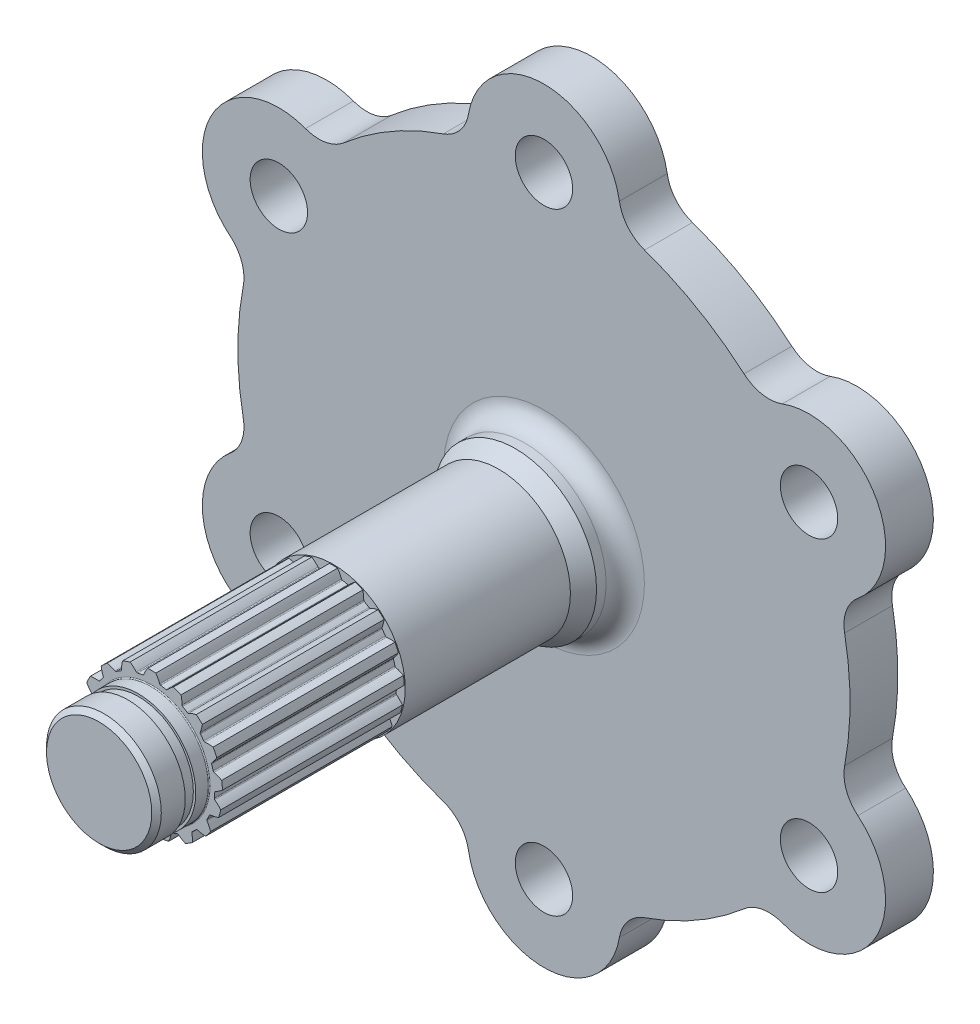
from build123d import *

# Parameters (mm, degrees)
SKETCH1_R           = 3
BOSS_EXTRUDE1_DEPTH = 5
SKETCH3_R           = 7.5
BOSS_EXTRUDE2_DEPTH = 22
BOSS_EXTRUDE7_DEPTH = 19
SKETCH4_R           = 6
BOSS_EXTRUDE3_DEPTH = 5.5
SKETCH6_R           = 8.5
BOSS_EXTRUDE5_DEPTH = 3
FILLET1_R           = 2
CHAMFER2_SIZE2      = 1.732050808
CHAMFER2_SIZE       = 1
CHAMFER3_SIZE       = 0.5
FILLET2_R           = 0.1
FILLET3_R           = 4
SKETCH12_W          = 1.1
SKETCH12_H          = 0.25
SKETCH13_R          = 24
SKETCH13_R_2        = 21
BOSS_EXTRUDE8_DEPTH = 4
CHAMFER4_SIZE       = 1


with BuildPart() as part:
    # Sketch1 → Boss-Extrude1 (new body)
    with BuildSketch(Plane.XY):
        with BuildLine():
            ThreePointArc((-7.937253933, 31), (-16, 27.712812921), (-22.878160551, 22.373863542))
            ThreePointArc((-22.878160551, 22.373863542), (-34.641016151, 20), (-30.815414484, 8.626136458))
            ThreePointArc((-30.815414484, 8.626136458), (-32, 0), (-30.815414484, -8.626136458))
            ThreePointArc((-30.815414484, -8.626136458), (-34.641016151, -20), (-22.878160551, -22.373863542))
            ThreePointArc((-22.878160551, -22.373863542), (-16, -27.712812921), (-7.937253933, -31))
            ThreePointArc((-7.937253933, -31), (0, -40), (7.937253933, -31))
            ThreePointArc((7.937253933, -31), (16, -27.712812921), (22.878160551, -22.373863542))
            ThreePointArc((22.878160551, -22.373863542), (34.641016151, -20), (30.815414484, -8.626136458))
            ThreePointArc((30.815414484, -8.626136458), (32, 0), (30.815414484, 8.626136458))
            ThreePointArc((30.815414484, 8.626136458), (34.641016151, 20), (22.878160551, 22.373863542))
            ThreePointArc((22.878160551, 22.373863542), (16, 27.712812921), (7.937253933, 31))
            ThreePointArc((7.937253933, 31), (0, 40), (-7.937253933, 31))
        make_face()
        with Locations((0, 32)):
            Circle(SKETCH1_R, mode=Mode.SUBTRACT)
        with Locations((27.712812921, 16)):
            Circle(SKETCH1_R, mode=Mode.SUBTRACT)
        with Locations((27.712812921, -16)):
            Circle(SKETCH1_R, mode=Mode.SUBTRACT)
        with Locations((0, -32)):
            Circle(SKETCH1_R, mode=Mode.SUBTRACT)
        with Locations((-27.712812921, -16)):
            Circle(SKETCH1_R, mode=Mode.SUBTRACT)
        with Locations((-27.712812921, 16)):
            Circle(SKETCH1_R, mode=Mode.SUBTRACT)
    extrude(amount=BOSS_EXTRUDE1_DEPTH)

    # Sketch3 → Boss-Extrude2 (add)
    with BuildSketch(Plane.XY.offset(5)):
        Circle(SKETCH3_R)
    extrude(amount=BOSS_EXTRUDE2_DEPTH)

    # Sketch9 → Boss-Extrude7 (add)
    with BuildSketch(Plane.XY.offset(27)):
        with BuildLine():
            ThreePointArc((3.065434453, 6.727003422), (2.670494178, 6.893324312), (2.266580134, 7.036481234))
            add(Edge.make_bspline(
                [(2.266580134, 7.036481234), (2.126818387, 6.938788398), (1.999963915, 6.840591067), (1.8857083, 6.743110628), (1.783612796, 6.647519469), (1.693117386, 6.554921304), (1.613554225, 6.466335435)],
                knots=[0, 0, 0, 0, 0, 0, 0, 1, 1, 1, 1, 1, 1, 1], degree=6))
            add(Edge.make_bspline(
                [(1.613554225, 6.466335435), (1.598164962, 6.44910015), (1.558045018, 6.423044176), (1.510221243, 6.420988968), (1.487755535, 6.426241211)],
                knots=[0, 0, 0, 0, 0.500434337, 1, 1, 1, 1], degree=3))
            ThreePointArc((1.487755535, 6.426241211), (1.350215953, 6.456539837), (1.212060845, 6.483895085))
            ThreePointArc((1.212060845, 6.483895085), (1.073353189, 6.508294458), (0.934156222, 6.529726857))
            add(Edge.make_bspline(
                [(0.934156222, 6.529726857), (0.911310245, 6.532944837), (0.867458329, 6.552137202), (0.839460099, 6.590926668), (0.831336141, 6.612557336)],
                knots=[0, 0, 0, 0, 0.499565663, 1, 1, 1, 1], degree=3))
            add(Edge.make_bspline(
                [(0.831336141, 6.612557336), (0.78914661, 6.723902728), (0.738212469, 6.842938658), (0.677542756, 6.968955909), (0.606216565, 7.101127601), (0.52340126, 7.238519005), (0.428368035, 7.380102628)],
                knots=[0, 0, 0, 0, 0, 0, 0, 1, 1, 1, 1, 1, 1, 1], degree=6))
            ThreePointArc((0.428368035, 7.380102628), (1.5161e-05, 7.392523356), (-0.428337714, 7.380102628))
            add(Edge.make_bspline(
                [(-0.428337714, 7.380102628), (-0.523370939, 7.238519005), (-0.606186244, 7.101127601), (-0.677512435, 6.968955909), (-0.738182148, 6.842938658), (-0.789116289, 6.723902728), (-0.83130582, 6.612557336)],
                knots=[0, 0, 0, 0, 0, 0, 0, 1, 1, 1, 1, 1, 1, 1], degree=6))
            add(Edge.make_bspline(
                [(-0.83130582, 6.612557336), (-0.839429778, 6.590926668), (-0.867428008, 6.552137202), (-0.911279924, 6.532944837), (-0.934125901, 6.529726857)],
                knots=[0, 0, 0, 0, 0.500434337, 1, 1, 1, 1], degree=3))
            ThreePointArc((-0.934125901, 6.529726857), (-1.073322868, 6.508294458), (-1.212030524, 6.483895085))
            ThreePointArc((-1.212030524, 6.483895085), (-1.350185632, 6.456539837), (-1.487725214, 6.426241211))
            add(Edge.make_bspline(
                [(-1.487725214, 6.426241211), (-1.510190921, 6.420988968), (-1.558014697, 6.423044176), (-1.598134641, 6.44910015), (-1.613523904, 6.466335435)],
                knots=[0, 0, 0, 0, 0.499565663, 1, 1, 1, 1], degree=3))
            add(Edge.make_bspline(
                [(-1.613523904, 6.466335435), (-1.693087065, 6.554921304), (-1.783582475, 6.647519469), (-1.885677979, 6.743110628), (-1.999933594, 6.840591067), (-2.126788065, 6.938788398), (-2.266549813, 7.036481234)],
                knots=[0, 0, 0, 0, 0, 0, 0, 1, 1, 1, 1, 1, 1, 1], degree=6))
            ThreePointArc((-2.266549813, 7.036481234), (-2.670463857, 6.893324312), (-3.065404132, 6.727003422))
            add(Edge.make_bspline(
                [(-3.065404132, 6.727003422), (-3.102874071, 6.560650664), (-3.130465543, 6.402620657), (-3.149229314, 6.253608232), (-3.160279454, 6.114184218), (-3.164773389, 5.984786985), (-3.16389136, 5.865719882)],
                knots=[0, 0, 0, 0, 0, 0, 0, 1, 1, 1, 1, 1, 1, 1], degree=6))
            add(Edge.make_bspline(
                [(-3.16389136, 5.865719882), (-3.163652827, 5.842615173), (-3.175748027, 5.796330945), (-3.209705639, 5.762593459), (-3.22984641, 5.751339864)],
                knots=[0, 0, 0, 0, 0.500434337, 1, 1, 1, 1], degree=3))
            ThreePointArc((-3.22984641, 5.751339864), (-3.35190144, 5.681071002), (-3.472428408, 5.60821228))
            ThreePointArc((-3.472428408, 5.60821228), (-3.591372354, 5.53279689), (-3.708679068, 5.454859234))
            add(Edge.make_bspline(
                [(-3.708679068, 5.454859234), (-3.727730388, 5.441846114), (-3.773067157, 5.426486598), (-3.819890394, 5.436290074), (-3.840466558, 5.446802256)],
                knots=[0, 0, 0, 0, 0.499565663, 1, 1, 1, 1], degree=3))
            add(Edge.make_bspline(
                [(-3.840466558, 5.446802256), (-3.946657903, 5.50066459), (-4.064492675, 5.554319095), (-4.194225406, 5.606574046), (-4.335979591, 5.65619796), (-4.48974083, 5.701939123), (-4.655355501, 5.742547213)],
                knots=[0, 0, 0, 0, 0, 0, 0, 1, 1, 1, 1, 1, 1, 1], degree=6))
            ThreePointArc((-4.655355501, 5.742547213), (-4.980279885, 5.463146776), (-5.288468689, 5.165388283))
            add(Edge.make_bspline(
                [(-5.288468689, 5.165388283), (-5.263314819, 4.996733253), (-5.231956077, 4.83940747), (-5.195623276, 4.693679266), (-5.155561462, 4.559678473), (-5.113008259, 4.437395751), (-5.069173793, 4.32668761)],
                knots=[0, 0, 0, 0, 0, 0, 0, 1, 1, 1, 1, 1, 1, 1], degree=6))
            add(Edge.make_bspline(
                [(-5.069173793, 4.32668761), (-5.060604983, 4.305229278), (-5.055163631, 4.257701231), (-5.074640775, 4.213975057), (-5.089356217, 4.196205707)],
                knots=[0, 0, 0, 0, 0.500434337, 1, 1, 1, 1], degree=3))
            ThreePointArc((-5.089356217, 4.196205707), (-5.177785103, 4.086590582), (-5.263853546, 3.975112484))
            ThreePointArc((-5.263853546, 3.975112484), (-5.347522292, 3.861822218), (-5.428753217, 3.746771446))
            add(Edge.make_bspline(
                [(-5.428753217, 3.746771446), (-5.441817162, 3.727754942), (-5.478543943, 3.69705509), (-5.525746735, 3.689282055), (-5.548730874, 3.691651405)],
                knots=[0, 0, 0, 0, 0.499565663, 1, 1, 1, 1], degree=3))
            add(Edge.make_bspline(
                [(-5.548730874, 3.691651405), (-5.667208674, 3.703515797), (-5.796468569, 3.710980303), (-5.936317404, 3.712841726), (-6.08642547, 3.70790713), (-6.246327169, 3.695014528), (-6.415427585, 3.673053525)],
                knots=[0, 0, 0, 0, 0, 0, 0, 1, 1, 1, 1, 1, 1, 1], degree=6))
            ThreePointArc((-6.415427585, 3.673053525), (-6.617479471, 3.295144151), (-6.797294197, 2.906161987))
            add(Edge.make_bspline(
                [(-6.797294197, 2.906161987), (-6.712913688, 2.757982481), (-6.626839904, 2.622608642), (-6.540317477, 2.499846061), (-6.454554278, 2.389366039), (-6.370700984, 2.290712786), (-6.289834168, 2.203315354)],
                knots=[0, 0, 0, 0, 0, 0, 0, 1, 1, 1, 1, 1, 1, 1], degree=6))
            add(Edge.make_bspline(
                [(-6.289834168, 2.203315354), (-6.274092348, 2.186401468), (-6.251849327, 2.144048526), (-6.254215507, 2.096239128), (-6.261518218, 2.074353871)],
                knots=[0, 0, 0, 0, 0.500434337, 1, 1, 1, 1], degree=3))
            ThreePointArc((-6.261518218, 2.074353871), (-6.304378148, 1.940196614), (-6.344364048, 1.805154875))
            ThreePointArc((-6.344364048, 1.805154875), (-6.381457665, 1.669290211), (-6.415642114, 1.532664566))
            add(Edge.make_bspline(
                [(-6.415642114, 1.532664566), (-6.420954327, 1.510212963), (-6.444110964, 1.46831896), (-6.485318313, 1.444019206), (-6.507606292, 1.43792573)],
                knots=[0, 0, 0, 0, 0.499565663, 1, 1, 1, 1], degree=3))
            add(Edge.make_bspline(
                [(-6.507606292, 1.43792573), (-6.622369463, 1.406189829), (-6.745597217, 1.366456213), (-6.876674795, 1.317672712), (-7.014863816, 1.258846051), (-7.159310365, 1.189060901), (-7.309058578, 1.107496759)],
                knots=[0, 0, 0, 0, 0, 0, 0, 1, 1, 1, 1, 1, 1, 1], degree=6))
            ThreePointArc((-7.309058578, 1.107496759), (-7.360949738, 0.682117203), (-7.388105412, 0.254445567))
            add(Edge.make_bspline(
                [(-7.388105412, 0.254445567), (-7.255894319, 0.146754048), (-7.126730234, 0.051615139), (-7.001703514, -0.031602053), (-6.881821726, -0.103640364), (-6.767993192, -0.165340479), (-6.661015539, -0.217623694)],
                knots=[0, 0, 0, 0, 0, 0, 0, 1, 1, 1, 1, 1, 1, 1], degree=6))
            add(Edge.make_bspline(
                [(-6.661015539, -0.217623694), (-6.640226728, -0.227708822), (-6.604186081, -0.259166658), (-6.589121731, -0.304602357), (-6.58802544, -0.327647795)],
                knots=[0, 0, 0, 0, 0.500434337, 1, 1, 1, 1], degree=3))
            ThreePointArc((-6.58802544, -0.327647795), (-6.579527943, -0.468228504), (-6.568030982, -0.608595748))
            ThreePointArc((-6.568030982, -0.608595748), (-6.553539772, -0.748685535), (-6.536060946, -0.888434001))
            add(Edge.make_bspline(
                [(-6.536060946, -0.888434001), (-6.532903982, -0.91128849), (-6.539363044, -0.958718627), (-6.569009669, -0.996263284), (-6.587591373, -1.009996628)],
                knots=[0, 0, 0, 0, 0.499565663, 1, 1, 1, 1], degree=3))
            add(Edge.make_bspline(
                [(-6.587591373, -1.009996628), (-6.683140513, -1.081046714), (-6.783693534, -1.162612206), (-6.888297102, -1.255452148), (-6.995903886, -1.360226009), (-7.105386977, -1.477478835), (-7.215558661, -1.607630426)],
                knots=[0, 0, 0, 0, 0, 0, 0, 1, 1, 1, 1, 1, 1, 1], degree=6))
            ThreePointArc((-7.215558661, -1.607630426), (-7.110280907, -2.023030298), (-6.981110004, -2.431631984))
            add(Edge.make_bspline(
                [(-6.981110004, -2.431631984), (-6.818924168, -2.484291179), (-6.664114108, -2.52634612), (-6.517468646, -2.55877898), (-6.379658968, -2.582646407), (-6.251228369, -2.599060442), (-6.132587803, -2.609168302)],
                knots=[0, 0, 0, 0, 0, 0, 0, 1, 1, 1, 1, 1, 1, 1], degree=6))
            add(Edge.make_bspline(
                [(-6.132587803, -2.609168302), (-6.109559645, -2.611062619), (-6.064588862, -2.627376794), (-6.034128507, -2.664302451), (-6.024781274, -2.685395656)],
                knots=[0, 0, 0, 0, 0.500434337, 1, 1, 1, 1], degree=3))
            ThreePointArc((-6.024781274, -2.685395656), (-5.966073984, -2.813413613), (-5.904646889, -2.940148989))
            ThreePointArc((-5.904646889, -2.940148989), (-5.840527971, -3.065543996), (-5.773746482, -3.18954148))
            add(Edge.make_bspline(
                [(-5.773746482, -3.18954148), (-5.762546707, -3.209712229), (-5.751435862, -3.256272797), (-5.765517821, -3.301991743), (-5.777883689, -3.321510191)],
                knots=[0, 0, 0, 0, 0.499565663, 1, 1, 1, 1], degree=3))
            add(Edge.make_bspline(
                [(-5.777883689, -3.321510191), (-5.841314357, -3.422278753), (-5.905612402, -3.53466025), (-5.969614669, -3.659018086), (-6.032106322, -3.795588855), (-6.091839658, -3.944473714), (-6.147555516, -4.10563506)],
                knots=[0, 0, 0, 0, 0, 0, 0, 1, 1, 1, 1, 1, 1, 1], degree=6))
            ThreePointArc((-6.147555516, -4.10563506), (-5.899327192, -4.454953194), (-5.631274959, -4.789301006))
            add(Edge.make_bspline(
                [(-5.631274959, -4.789301006), (-5.461018475, -4.779815961), (-5.301470397, -4.763107182), (-5.153011476, -4.740375472), (-5.015885869, -4.712848588), (-4.890198468, -4.681759736), (-4.775918055, -4.648327119)],
                knots=[0, 0, 0, 0, 0, 0, 0, 1, 1, 1, 1, 1, 1, 1], degree=6))
            add(Edge.make_bspline(
                [(-4.775918055, -4.648327119), (-4.753760631, -4.641774787), (-4.705933265, -4.640741981), (-4.664190744, -4.664170582), (-4.647854964, -4.680462799)],
                knots=[0, 0, 0, 0, 0.500434337, 1, 1, 1, 1], degree=3))
            ThreePointArc((-4.647854964, -4.680462799), (-4.546866626, -4.77862847), (-4.443805468, -4.874615663))
            ThreePointArc((-4.443805468, -4.874615663), (-4.338718456, -4.968380599), (-4.231653514, -5.059880553))
            add(Edge.make_bspline(
                [(-4.231653514, -5.059880553), (-4.213923521, -5.074643391), (-4.186743349, -5.114046128), (-4.183358796, -5.161764766), (-4.187838748, -5.184432243)],
                knots=[0, 0, 0, 0, 0.499565663, 1, 1, 1, 1], degree=3))
            add(Edge.make_bspline(
                [(-4.187838748, -5.184432243), (-4.210584281, -5.301309929), (-4.229943543, -5.429329687), (-4.244700648, -5.568410201), (-4.253637327, -5.718333239), (-4.25555359, -5.878742405), (-4.249288887, -6.049147774)],
                knots=[0, 0, 0, 0, 0, 0, 0, 1, 1, 1, 1, 1, 1, 1], degree=6))
            ThreePointArc((-4.249288887, -6.049147774), (-3.891634603, -6.28520682), (-3.520902979, -6.500145235))
            add(Edge.make_bspline(
                [(-3.520902979, -6.500145235), (-3.36556993, -6.429796958), (-3.222831684, -6.356581072), (-3.092609504, -6.281754836), (-2.974687541, -6.206551298), (-2.86871812, -6.132158281), (-2.774232062, -6.059700447)],
                knots=[0, 0, 0, 0, 0, 0, 0, 1, 1, 1, 1, 1, 1, 1], degree=6))
            add(Edge.make_bspline(
                [(-2.774232062, -6.059700447), (-2.755937855, -6.045586395), (-2.711713256, -6.027346094), (-2.664326128, -6.034113476), (-2.643208039, -6.043404352)],
                knots=[0, 0, 0, 0, 0.500434337, 1, 1, 1, 1], degree=3))
            ThreePointArc((-2.643208039, -6.043404352), (-2.513577688, -6.098459919), (-2.382801447, -6.150735325))
            ThreePointArc((-2.382801447, -6.150735325), (-2.250938925, -6.200206717), (-2.118050244, -6.246851565))
            add(Edge.make_bspline(
                [(-2.118050244, -6.246851565), (-2.096184565, -6.25421269), (-2.0566059, -6.281136037), (-2.036211938, -6.3244097), (-2.032200931, -6.347164838)],
                knots=[0, 0, 0, 0, 0.499565663, 1, 1, 1, 1], degree=3))
            add(Edge.make_bspline(
                [(-2.032200931, -6.347164838), (-2.011189419, -6.464366669), (-1.982995323, -6.59073491), (-1.946514237, -6.725754508), (-1.900688994, -6.868781879), (-1.844529381, -7.019051206), (-1.7771302, -7.175686408)],
                knots=[0, 0, 0, 0, 0, 0, 0, 1, 1, 1, 1, 1, 1, 1], degree=6))
            ThreePointArc((-1.7771302, -7.175686408), (-1.35835315, -7.266605284), (-0.935011495, -7.333105676))
            add(Edge.make_bspline(
                [(-0.935011495, -7.333105676), (-0.815580468, -7.211395092), (-0.708929647, -7.09156031), (-0.614531435, -6.974745246), (-0.53173913, -6.862021709), (-0.459799445, -6.754371716), (-0.397868609, -6.652674497)],
                knots=[0, 0, 0, 0, 0, 0, 0, 1, 1, 1, 1, 1, 1, 1], degree=6))
            add(Edge.make_bspline(
                [(-0.397868609, -6.652674497), (-0.385908352, -6.632904905), (-0.351259299, -6.599920564), (-0.304627458, -6.589112754), (-0.281579175, -6.590147505)],
                knots=[0, 0, 0, 0, 0.500434337, 1, 1, 1, 1], degree=3))
            ThreePointArc((-0.281579175, -6.590147505), (-0.140814107, -6.594657408), (1.5161e-05, -6.596160946))
            ThreePointArc((1.5161e-05, -6.596160946), (0.140844429, -6.594657408), (0.281609496, -6.590147505))
            add(Edge.make_bspline(
                [(0.281609496, -6.590147505), (0.304657779, -6.589112754), (0.35128962, -6.599920564), (0.385938673, -6.632904905), (0.39789893, -6.652674497)],
                knots=[0, 0, 0, 0, 0.499565663, 1, 1, 1, 1], degree=3))
            add(Edge.make_bspline(
                [(0.39789893, -6.652674497), (0.459829766, -6.754371716), (0.531769452, -6.862021709), (0.614561756, -6.974745246), (0.708959968, -7.09156031), (0.815610789, -7.211395092), (0.935041816, -7.333105676)],
                knots=[0, 0, 0, 0, 0, 0, 0, 1, 1, 1, 1, 1, 1, 1], degree=6))
            ThreePointArc((0.935041816, -7.333105676), (1.358383471, -7.266605284), (1.777160521, -7.175686408))
            add(Edge.make_bspline(
                [(1.777160521, -7.175686408), (1.844559702, -7.019051206), (1.900719315, -6.868781879), (1.946544558, -6.725754508), (1.983025644, -6.59073491), (2.01121974, -6.464366669), (2.032231252, -6.347164838)],
                knots=[0, 0, 0, 0, 0, 0, 0, 1, 1, 1, 1, 1, 1, 1], degree=6))
            add(Edge.make_bspline(
                [(2.032231252, -6.347164838), (2.036242259, -6.3244097), (2.056636221, -6.281136037), (2.096214886, -6.25421269), (2.118080565, -6.246851565)],
                knots=[0, 0, 0, 0, 0.500434337, 1, 1, 1, 1], degree=3))
            ThreePointArc((2.118080565, -6.246851565), (2.250969246, -6.200206717), (2.382831768, -6.150735325))
            ThreePointArc((2.382831768, -6.150735325), (2.513608009, -6.098459919), (2.64323836, -6.043404352))
            add(Edge.make_bspline(
                [(2.64323836, -6.043404352), (2.664356449, -6.034113476), (2.711743578, -6.027346094), (2.755968176, -6.045586395), (2.774262383, -6.059700447)],
                knots=[0, 0, 0, 0, 0.499565663, 1, 1, 1, 1], degree=3))
            add(Edge.make_bspline(
                [(2.774262383, -6.059700447), (2.868748441, -6.132158281), (2.974717862, -6.206551298), (3.092639825, -6.281754836), (3.222862005, -6.356581072), (3.365600251, -6.429796958), (3.5209333, -6.500145235)],
                knots=[0, 0, 0, 0, 0, 0, 0, 1, 1, 1, 1, 1, 1, 1], degree=6))
            ThreePointArc((3.5209333, -6.500145235), (3.891664925, -6.28520682), (4.249319208, -6.049147774))
            add(Edge.make_bspline(
                [(4.249319208, -6.049147774), (4.255583911, -5.878742405), (4.253667648, -5.718333239), (4.244730969, -5.568410201), (4.229973864, -5.429329687), (4.210614602, -5.301309929), (4.187869069, -5.184432243)],
                knots=[0, 0, 0, 0, 0, 0, 0, 1, 1, 1, 1, 1, 1, 1], degree=6))
            add(Edge.make_bspline(
                [(4.187869069, -5.184432243), (4.183389118, -5.161764766), (4.18677367, -5.114046128), (4.213953842, -5.074643391), (4.231683835, -5.059880553)],
                knots=[0, 0, 0, 0, 0.500434337, 1, 1, 1, 1], degree=3))
            ThreePointArc((4.231683835, -5.059880553), (4.338748777, -4.968380599), (4.443835789, -4.874615663))
            ThreePointArc((4.443835789, -4.874615663), (4.546896947, -4.77862847), (4.647885285, -4.680462799))
            add(Edge.make_bspline(
                [(4.647885285, -4.680462799), (4.664221065, -4.664170582), (4.705963586, -4.640741981), (4.753790952, -4.641774787), (4.775948376, -4.648327119)],
                knots=[0, 0, 0, 0, 0.499565663, 1, 1, 1, 1], degree=3))
            add(Edge.make_bspline(
                [(4.775948376, -4.648327119), (4.89022879, -4.681759736), (5.01591619, -4.712848588), (5.153041797, -4.740375472), (5.301500718, -4.763107182), (5.461048796, -4.779815961), (5.63130528, -4.789301006)],
                knots=[0, 0, 0, 0, 0, 0, 0, 1, 1, 1, 1, 1, 1, 1], degree=6))
            ThreePointArc((5.63130528, -4.789301006), (5.899357513, -4.454953194), (6.147585837, -4.10563506))
            add(Edge.make_bspline(
                [(6.147585837, -4.10563506), (6.09186998, -3.944473714), (6.032136643, -3.795588855), (5.96964499, -3.659018086), (5.905642723, -3.53466025), (5.841344678, -3.422278753), (5.77791401, -3.321510191)],
                knots=[0, 0, 0, 0, 0, 0, 0, 1, 1, 1, 1, 1, 1, 1], degree=6))
            add(Edge.make_bspline(
                [(5.77791401, -3.321510191), (5.765548142, -3.301991743), (5.751466183, -3.256272797), (5.762577029, -3.209712229), (5.773776803, -3.18954148)],
                knots=[0, 0, 0, 0, 0.500434337, 1, 1, 1, 1], degree=3))
            ThreePointArc((5.773776803, -3.18954148), (5.840558292, -3.065543996), (5.90467721, -2.940148989))
            ThreePointArc((5.90467721, -2.940148989), (5.966104305, -2.813413613), (6.024811595, -2.685395656))
            add(Edge.make_bspline(
                [(6.024811595, -2.685395656), (6.034158828, -2.664302451), (6.064619183, -2.627376794), (6.109589966, -2.611062619), (6.132618124, -2.609168302)],
                knots=[0, 0, 0, 0, 0.499565663, 1, 1, 1, 1], degree=3))
            add(Edge.make_bspline(
                [(6.132618124, -2.609168302), (6.25125869, -2.599060442), (6.37968929, -2.582646407), (6.517498968, -2.55877898), (6.664144429, -2.52634612), (6.818954489, -2.484291179), (6.981140325, -2.431631984)],
                knots=[0, 0, 0, 0, 0, 0, 0, 1, 1, 1, 1, 1, 1, 1], degree=6))
            ThreePointArc((6.981140325, -2.431631984), (7.110311228, -2.023030298), (7.215588982, -1.607630426))
            add(Edge.make_bspline(
                [(7.215588982, -1.607630426), (7.105417298, -1.477478835), (6.995934207, -1.360226009), (6.888327423, -1.255452148), (6.783723855, -1.162612206), (6.683170834, -1.081046714), (6.587621694, -1.009996628)],
                knots=[0, 0, 0, 0, 0, 0, 0, 1, 1, 1, 1, 1, 1, 1], degree=6))
            add(Edge.make_bspline(
                [(6.587621694, -1.009996628), (6.56903999, -0.996263284), (6.539393366, -0.958718627), (6.532934303, -0.91128849), (6.536091267, -0.888434001)],
                knots=[0, 0, 0, 0, 0.500434337, 1, 1, 1, 1], degree=3))
            ThreePointArc((6.536091267, -0.888434001), (6.553570093, -0.748685535), (6.568061303, -0.608595748))
            ThreePointArc((6.568061303, -0.608595748), (6.579558264, -0.468228504), (6.588055761, -0.327647795))
            add(Edge.make_bspline(
                [(6.588055761, -0.327647795), (6.589152053, -0.304602357), (6.604216402, -0.259166658), (6.640257049, -0.227708822), (6.66104586, -0.217623694)],
                knots=[0, 0, 0, 0, 0.499565663, 1, 1, 1, 1], degree=3))
            add(Edge.make_bspline(
                [(6.66104586, -0.217623694), (6.768023513, -0.165340479), (6.881852047, -0.103640364), (7.001733835, -0.031602053), (7.126760555, 0.051615139), (7.25592464, 0.146754048), (7.388135733, 0.254445567)],
                knots=[0, 0, 0, 0, 0, 0, 0, 1, 1, 1, 1, 1, 1, 1], degree=6))
            ThreePointArc((7.388135733, 0.254445567), (7.360980059, 0.682117203), (7.309088899, 1.107496759))
            add(Edge.make_bspline(
                [(7.309088899, 1.107496759), (7.159340686, 1.189060901), (7.014894137, 1.258846051), (6.876705116, 1.317672712), (6.745627538, 1.366456213), (6.622399784, 1.406189829), (6.507636614, 1.43792573)],
                knots=[0, 0, 0, 0, 0, 0, 0, 1, 1, 1, 1, 1, 1, 1], degree=6))
            add(Edge.make_bspline(
                [(6.507636614, 1.43792573), (6.485348634, 1.444019206), (6.444141286, 1.46831896), (6.420984648, 1.510212963), (6.415672435, 1.532664566)],
                knots=[0, 0, 0, 0, 0.500434337, 1, 1, 1, 1], degree=3))
            ThreePointArc((6.415672435, 1.532664566), (6.381487986, 1.669290211), (6.344394369, 1.805154875))
            ThreePointArc((6.344394369, 1.805154875), (6.304408469, 1.940196614), (6.261548539, 2.074353871))
            add(Edge.make_bspline(
                [(6.261548539, 2.074353871), (6.254245828, 2.096239128), (6.251879648, 2.144048526), (6.274122669, 2.186401468), (6.28986449, 2.203315354)],
                knots=[0, 0, 0, 0, 0.499565663, 1, 1, 1, 1], degree=3))
            add(Edge.make_bspline(
                [(6.28986449, 2.203315354), (6.370731305, 2.290712786), (6.454584599, 2.389366039), (6.540347798, 2.499846061), (6.626870226, 2.622608642), (6.712944009, 2.757982481), (6.797324518, 2.906161987)],
                knots=[0, 0, 0, 0, 0, 0, 0, 1, 1, 1, 1, 1, 1, 1], degree=6))
            ThreePointArc((6.797324518, 2.906161987), (6.617509792, 3.295144151), (6.415457907, 3.673053525))
            add(Edge.make_bspline(
                [(6.415457907, 3.673053525), (6.246357491, 3.695014528), (6.086455791, 3.70790713), (5.936347725, 3.712841726), (5.79649889, 3.710980303), (5.667238995, 3.703515797), (5.548761195, 3.691651405)],
                knots=[0, 0, 0, 0, 0, 0, 0, 1, 1, 1, 1, 1, 1, 1], degree=6))
            add(Edge.make_bspline(
                [(5.548761195, 3.691651405), (5.525777056, 3.689282055), (5.478574264, 3.69705509), (5.441847483, 3.727754942), (5.428783538, 3.746771446)],
                knots=[0, 0, 0, 0, 0.500434337, 1, 1, 1, 1], degree=3))
            ThreePointArc((5.428783538, 3.746771446), (5.347552613, 3.861822218), (5.263883868, 3.975112484))
            ThreePointArc((5.263883868, 3.975112484), (5.177815424, 4.086590582), (5.089386538, 4.196205707))
            add(Edge.make_bspline(
                [(5.089386538, 4.196205707), (5.074671096, 4.213975057), (5.055193952, 4.257701231), (5.060635305, 4.305229278), (5.069204114, 4.32668761)],
                knots=[0, 0, 0, 0, 0.499565663, 1, 1, 1, 1], degree=3))
            add(Edge.make_bspline(
                [(5.069204114, 4.32668761), (5.11303858, 4.437395751), (5.155591783, 4.559678473), (5.195653597, 4.693679266), (5.231986399, 4.83940747), (5.26334514, 4.996733253), (5.28849901, 5.165388283)],
                knots=[0, 0, 0, 0, 0, 0, 0, 1, 1, 1, 1, 1, 1, 1], degree=6))
            ThreePointArc((5.28849901, 5.165388283), (4.980310206, 5.463146776), (4.655385822, 5.742547213))
            add(Edge.make_bspline(
                [(4.655385822, 5.742547213), (4.489771151, 5.701939123), (4.336009912, 5.65619796), (4.194255727, 5.606574046), (4.064522996, 5.554319095), (3.946688224, 5.50066459), (3.840496879, 5.446802256)],
                knots=[0, 0, 0, 0, 0, 0, 0, 1, 1, 1, 1, 1, 1, 1], degree=6))
            add(Edge.make_bspline(
                [(3.840496879, 5.446802256), (3.819920715, 5.436290074), (3.773097478, 5.426486598), (3.727760709, 5.441846114), (3.70870939, 5.454859234)],
                knots=[0, 0, 0, 0, 0.500434337, 1, 1, 1, 1], degree=3))
            ThreePointArc((3.70870939, 5.454859234), (3.591402675, 5.53279689), (3.472458729, 5.60821228))
            ThreePointArc((3.472458729, 5.60821228), (3.351931762, 5.681071002), (3.229876731, 5.751339864))
            add(Edge.make_bspline(
                [(3.229876731, 5.751339864), (3.20973596, 5.762593459), (3.175778349, 5.796330945), (3.163683148, 5.842615173), (3.163921682, 5.865719882)],
                knots=[0, 0, 0, 0, 0.499565663, 1, 1, 1, 1], degree=3))
            add(Edge.make_bspline(
                [(3.163921682, 5.865719882), (3.16480371, 5.984786985), (3.160309776, 6.114184218), (3.149259635, 6.253608232), (3.130495865, 6.402620657), (3.102904392, 6.560650664), (3.065434453, 6.727003422)],
                knots=[0, 0, 0, 0, 0, 0, 0, 1, 1, 1, 1, 1, 1, 1], degree=6))
        make_face()
    extrude(amount=BOSS_EXTRUDE7_DEPTH)

    # Sketch4 → Boss-Extrude3 (add)
    with BuildSketch(Plane.XY.offset(46)):
        Circle(SKETCH4_R)
    extrude(amount=BOSS_EXTRUDE3_DEPTH)

    # Sketch6 → Boss-Extrude5 (add)
    with BuildSketch(Plane.XY.offset(5)):
        Circle(SKETCH6_R)
    extrude(amount=BOSS_EXTRUDE5_DEPTH)

    # Fillet1
    fillet1_edges = [part.edges().sort_by_distance(p)[0] for p in [
        (-8.5, 0, 5),
    ]]
    fillet(fillet1_edges, radius=FILLET1_R)

    # Chamfer2
    chamfer2_edges = [part.edges().sort_by_distance(p)[0] for p in [
        (-7.5, 0, 8),
    ]]
    chamfer2_side = [part.faces().sort_by_distance(p)[0] for p in [
        (-7.52, 0, 8),
    ]]
    chamfer(chamfer2_edges, length=CHAMFER2_SIZE - 0.0001, length2=CHAMFER2_SIZE2 - 0.0001, reference=chamfer2_side[0])  # a hair under: the kernel refuses the full size

    # Chamfer3
    chamfer3_edges = [part.edges().sort_by_distance(p)[0] for p in [
        (-6, 0, 51.5),
    ]]
    chamfer(chamfer3_edges, length=CHAMFER3_SIZE)

    # Fillet2
    fillet2_edges = [part.edges().sort_by_distance(p)[0] for p in [
        (-6, 0, 46),
    ]]
    fillet(fillet2_edges, radius=FILLET2_R)

    # Fillet3
    fillet3_edges = [part.edges().sort_by_distance(p)[0] for p in [
        (30.815414484, 8.626136458, 2.5),
        (30.815414484, -8.626136458, 2.5),
        (22.878160551, -22.373863542, 2.5),
        (7.937253933, -31, 2.5),
        (-7.937253933, -31, 2.5),
        (-22.878160551, -22.373863542, 2.5),
        (-30.815414484, -8.626136458, 2.5),
        (-30.815414484, 8.626136458, 2.5),
        (-22.878160551, 22.373863542, 2.5),
        (-7.937253933, 31, 2.5),
        (7.937253933, 31, 2.5),
        (22.878160551, 22.373863542, 2.5),
    ]]
    fillet(fillet3_edges, radius=FILLET3_R)

    # Sketch12 → Cut-Revolve1 (revolve, cut)
    with BuildSketch(Plane(origin=(0, 0, 0), x_dir=(0, 0, -1), z_dir=(1, 0, 0)), mode=Mode.PRIVATE) as cut_revolve1_sk:
        with Locations((-47.95, 5.875)):
            Rectangle(SKETCH12_W, SKETCH12_H)
    revolve(cut_revolve1_sk.sketch.rotate(Axis((0, 0, 51.5), (0, 0, -1)), 90), axis=Axis((0, 0, 51.5), (0, 0, -1)), mode=Mode.SUBTRACT)

    # Sketch13 → Boss-Extrude8 (add)
    with BuildSketch(Plane(origin=(0, 0, 0), x_dir=(-1, 0, 0), z_dir=(0, 0, -1))):
        with Locations(Location((0, 0, 0), (0, 0, 180))):
            Circle(SKETCH13_R)
        Circle(SKETCH13_R_2, mode=Mode.SUBTRACT)
    extrude(amount=BOSS_EXTRUDE8_DEPTH)

    # Chamfer4
    chamfer4_edges = [part.edges().sort_by_distance(p)[0] for p in [
        (-24, 0, -4),
        (21, 0, 0),
    ]]
    chamfer(chamfer4_edges, length=CHAMFER4_SIZE)


solid = part.part
